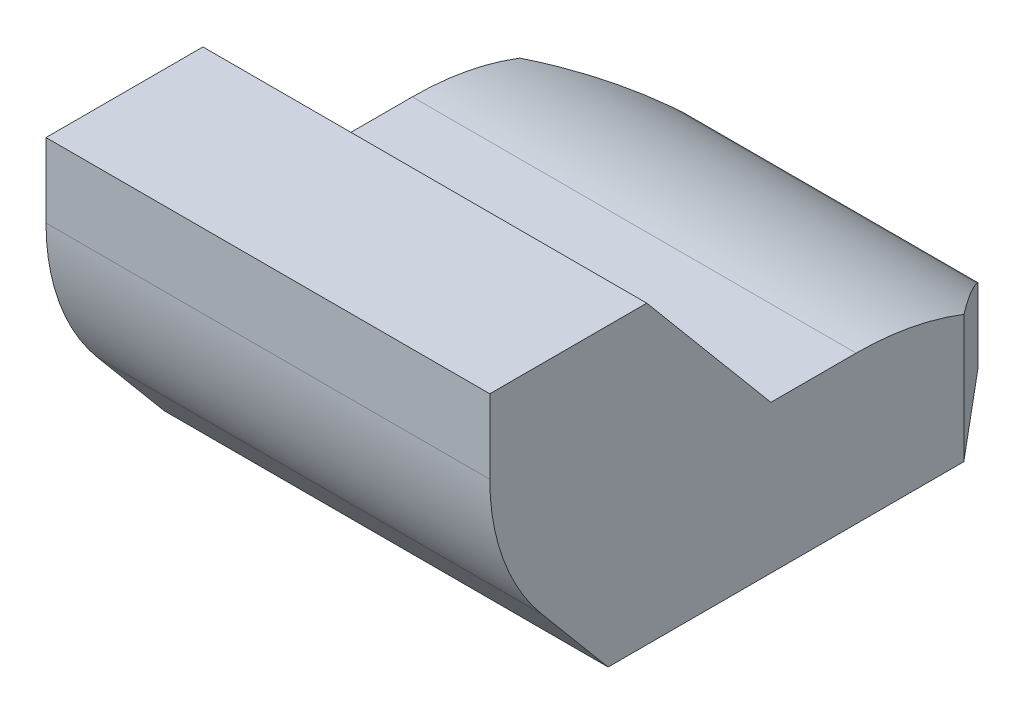
from build123d import *

# Parameters (mm, degrees)
SKETCH_1_W       = 3
SKETCH_1_H       = 3.8
EXTRUDE_1_DEPTH  = 1
SKETCH_2_W       = 3
SKETCH_2_H       = 1
EXTRUDE_2_DEPTH  = 1
CHAMFER_1_SIZE   = 0.5
CHAMFER_1_SIZE2  = 0.595876796
FILLET_1_R       = 2
CHAMFER_4_SIZE   = 0.8
CHAMFER_4_SIZE2  = 0.953402874
CHAMFER_3_SIZE   = 0.9
CHAMFER_3_SIZE_2 = 1.072578233
FILLET_2_R       = 1.5


with BuildPart() as part:
    # 草图1 → 凸台-拉伸1 (new body)
    with BuildSketch(Plane(origin=(0, 0, 0), x_dir=(1, 0, 0), z_dir=(0, 1, 0))):
        with Locations((0, -0.9)):
            Rectangle(SKETCH_1_W, SKETCH_1_H)
    extrude(amount=EXTRUDE_1_DEPTH)

    # 草图2 → 凸台-拉伸2 (add)
    with BuildSketch(Plane(origin=(0, 1, 0), x_dir=(1, 0, 0), z_dir=(0, 1, 0))):
        with Locations((0, -2.3)):
            Rectangle(SKETCH_2_W, SKETCH_2_H)
    extrude(amount=EXTRUDE_2_DEPTH)

    # 倒角1
    chamfer_1_edges = [part.edges().sort_by_distance(p)[0] for p in [
        (0, 1, -1),
        (-1.5, 0.5, -1),
        (1.5, 0.5, -1),
    ]]
    chamfer_1_side = [part.faces().sort_by_distance(p)[0] for p in [
        (0, 0.5, -1),
    ]]
    chamfer(chamfer_1_edges, length=CHAMFER_1_SIZE, length2=CHAMFER_1_SIZE2, reference=chamfer_1_side[0])

    # 圆角1
    fillet_1_edges = [part.edges().sort_by_distance(p)[0] for p in [
        (0, 1, -0.404123204),
    ]]
    fillet(fillet_1_edges, radius=FILLET_1_R)

    # 倒角4
    chamfer_4_edges = [part.edges().sort_by_distance(p)[0] for p in [
        (0, 0, 2.8),
    ]]
    chamfer_4_side = [part.faces().sort_by_distance(p)[0] for p in [
        (0, 0, 0.945658616),
    ]]
    chamfer(chamfer_4_edges, length=CHAMFER_4_SIZE, length2=CHAMFER_4_SIZE2, reference=chamfer_4_side[0])

    # 倒角3
    # the kernel refuses this chamfer: 1.072578233, 0.9 mm, written as the material it adds along each edge
    with BuildSketch(Plane(origin=(1.5, 1, 1.8), x_dir=(0, -0.03540953691366302, -0.9993728857116146), z_dir=(-1, 0, 0))) as chamfer_3_piece_1_section:
        Polygon((CHAMFER_3_SIZE * 0.999372885712, -CHAMFER_3_SIZE * 0.0354095369137), (-CHAMFER_3_SIZE_2 * 0.0354095369247, -CHAMFER_3_SIZE_2 * 0.999372886024), (0, 0), align=None)
    chamfer_3_piece_1 = extrude(amount=3, mode=Mode.PRIVATE)
    chamfer_3_piece_1 = split(chamfer_3_piece_1, bisect_by=Plane(origin=(0, 2, 1.501522224), z_dir=(0, -1, 0)), keep=Keep.TOP, mode=Mode.PRIVATE)
    add(chamfer_3_piece_1)

    # 圆角2
    fillet_2_edges = [part.edges().sort_by_distance(p)[0] for p in [
        (0, 0.953402874, 2.8),
    ]]
    fillet(fillet_2_edges, radius=FILLET_2_R)


solid = part.part
